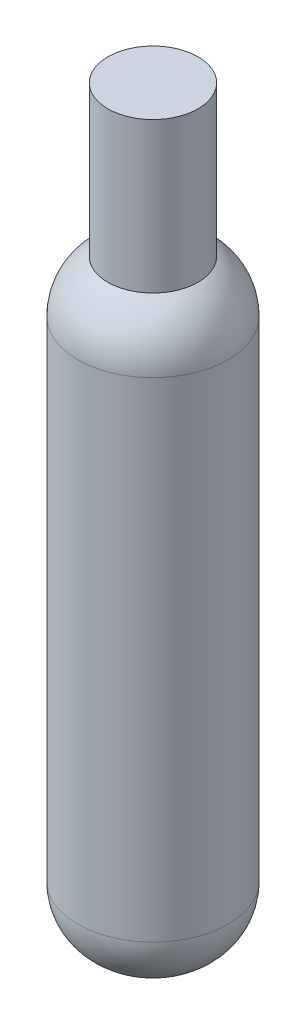
from build123d import *

# Parameters (mm, degrees)
CROQUIS1_R              = 2.5
SALIENTE_EXTRUIR1_DEPTH = 20
REDONDEO1_R             = 2
CROQUIS2_R              = 1.5
CORTAR_EXTRUIR1_DEPTH   = 6
CROQUIS3_R              = 1.5
SALIENTE_EXTRUIR2_DEPTH = 5
REDONDEO2_R             = 2


with BuildPart() as part:
    # Croquis1 → Saliente-Extruir1 (new body)
    with BuildSketch(Plane(origin=(0, 0, 0), x_dir=(1, 0, 0), z_dir=(0, 1, 0))):
        with Locations(Location((0, 0, 0), (0, 0, 270))):
            Circle(CROQUIS1_R)
    extrude(amount=SALIENTE_EXTRUIR1_DEPTH)

    # Redondeo1
    redondeo1_edges = [part.edges().sort_by_distance(p)[0] for p in [
        (0, 0, -2.5),
    ]]
    fillet(redondeo1_edges, radius=REDONDEO1_R)

    # Croquis2 → Cortar-Extruir1 (cut)
    with BuildSketch(Plane.XZ):
        with Locations(Location((0, 0, 0), (0, 0, 270))):
            Circle(CROQUIS2_R)
    extrude(amount=-CORTAR_EXTRUIR1_DEPTH, mode=Mode.SUBTRACT)

    # Croquis3 → Saliente-Extruir2 (add)
    with BuildSketch(Plane(origin=(0, 20, 0), x_dir=(1, 0, 0), z_dir=(0, 1, 0))):
        with Locations(Location((0, 0, 0), (0, 0, 90))):
            Circle(CROQUIS3_R)
    extrude(amount=SALIENTE_EXTRUIR2_DEPTH)

    # Redondeo2
    # the kernel refuses this fillet: 2 mm, written as the material it takes off along each edge
    with BuildSketch(Plane(origin=(0, 20, 0), x_dir=(0, 0, 1), z_dir=(-1, 0, 0))) as redondeo2_piece_1:
        with BuildLine():
            CenterArc((0.5, -1.732050808), REDONDEO2_R, 0, 60)
            Line((1.5, 0), (1.52, 0.034641016))
            ThreePointArc((1.52, 0.034641016), (2, 0.04), (2.5, 0.04))
            Line((2.5, 0.04), (2.54, 0))
            Line((2.54, 0), (2.54, -1.732050808))
            Line((2.54, -1.732050808), (2.5, -1.732050808))
        make_face()
    revolve(axis=Axis((0, 20, 0), (0, 1, 0)), mode=Mode.SUBTRACT)


solid = part.part
